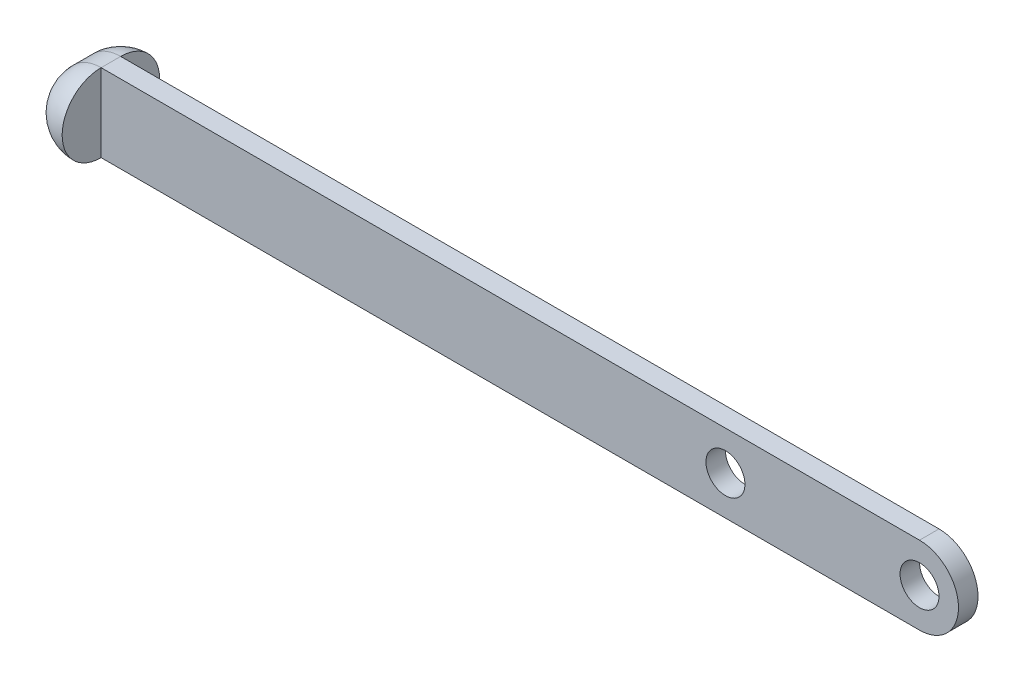
from build123d import *

# Parameters (mm, degrees)
SKETCH1_R           = 2.49690856
BOSS_EXTRUDE1_DEPTH = 2.5
REVOLVE1_ANGLE      = 90
REVOLVE2_ANGLE      = 90


with BuildPart() as part:
    # Sketch1 → Boss-Extrude1 (new body)
    with BuildSketch(Plane.XY):
        with BuildLine():
            Line((-54.387351779, 4.99381712), (50.48280775, 4.99381712))
            ThreePointArc((50.48280775, 4.99381712), (55.476624871, 0), (50.48280775, -4.99381712))
            Line((50.48280775, -4.99381712), (-54.387351779, -4.99381712))
            ThreePointArc((-54.387351779, -4.99381712), (-59.381168899, 0), (-54.387351779, 4.99381712))
        make_face()
        with Locations((50.48280775, 0)):
            Circle(SKETCH1_R, mode=Mode.SUBTRACT)
        with Locations((25.612648221, 0)):
            Circle(SKETCH1_R, mode=Mode.SUBTRACT)
    extrude(amount=BOSS_EXTRUDE1_DEPTH)

    # Sketch2 → Revolve1 (revolve)
    with BuildSketch(Plane.XY.offset(2.5)):
        with BuildLine():
            Line((-54.387351779, 5), (-54.387351779, -4.99381712))
            ThreePointArc((-54.387351779, -4.99381712), (-59.384260339, 0.00309144), (-54.387351779, 5))
        make_face()
    revolve(axis=Axis((-54.387351779, 5, 2.5), (0, 1, 0)), revolution_arc=REVOLVE1_ANGLE)

    # Sketch3 → Revolve2 (revolve)
    with BuildSketch(Plane(origin=(0, 0, 0), x_dir=(-1, 0, 0), z_dir=(0, 0, -1))):
        with BuildLine():
            Line((54.387351779, 4.99381712), (54.387351779, -4.99381712))
            ThreePointArc((54.387351779, -4.99381712), (59.381168899, 0), (54.387351779, 4.99381712))
        make_face()
    revolve(axis=Axis((-54.387351779, 4.99381712, 0), (0, -1, 0)), revolution_arc=REVOLVE2_ANGLE)


solid = part.part
